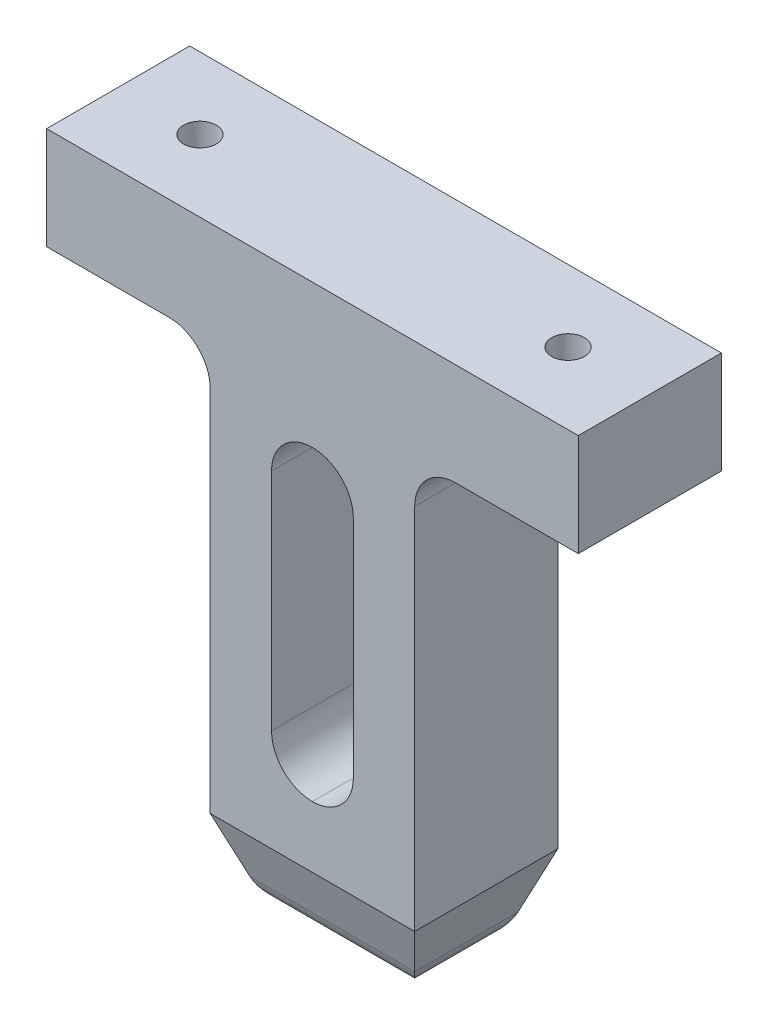
from build123d import *

# Parameters (mm, degrees)
SKETCH1_W           = 7
SKETCH1_H           = 5
BOSS_EXTRUDE1_DEPTH = 26
SKETCH3_R           = 0.8
CUT_EXTRUDE1_DEPTH  = 7
SKETCH4_W           = 10
SKETCH4_H           = 7
BOSS_EXTRUDE2_DEPTH = 20
SKETCH5_W           = 4
SKETCH5_H           = 15
CUT_EXTRUDE2_DEPTH  = 20
SKETCH6_W           = 10
SKETCH6_H           = 7
BOSS_EXTRUDE3_DEPTH = 4
BOSS_EXTRUDE3_TAPER = 20
FILLET2_R           = 2
FILLET5_R           = 2
FILLET8_R           = 2


with BuildPart() as part:
    # Sketch1 → Boss-Extrude1 (new body)
    with BuildSketch(Plane(origin=(0, 0, 0), x_dir=(0, 0, -1), z_dir=(1, 0, 0))):
        Rectangle(SKETCH1_W, SKETCH1_H)
    extrude(amount=BOSS_EXTRUDE1_DEPTH)

    # Sketch3 → Cut-Extrude1 (cut)
    with BuildSketch(Plane(origin=(0, 2.5, -8.047205284), x_dir=(1, 0, 0), z_dir=(0, -1, 0))):
        with Locations(Location((4, 8.047205284, 0), (0, 0, 90))):
            Circle(SKETCH3_R)
        with Locations(Location((22, 8.047205284, 0), (0, 0, 90))):
            Circle(SKETCH3_R)
    extrude(amount=CUT_EXTRUDE1_DEPTH, mode=Mode.SUBTRACT)

    # Sketch4 → Boss-Extrude2 (add)
    with BuildSketch(Plane.XZ.offset(2.5)):
        with Locations((13, 0)):
            Rectangle(SKETCH4_W, SKETCH4_H)
    extrude(amount=BOSS_EXTRUDE2_DEPTH)

    # Sketch5 → Cut-Extrude2 (cut)
    with BuildSketch(Plane.XY.offset(3.5)):
        with Locations((13, -12)):
            Rectangle(SKETCH5_W, SKETCH5_H)
    extrude(amount=-CUT_EXTRUDE2_DEPTH, mode=Mode.SUBTRACT)

    # Fillet2
    fillet2_edges = [part.edges().sort_by_distance(p)[0] for p in [
        (15, -4.5, 0),
        (11, -4.5, 0),
        (15, -19.5, 0),
        (11, -19.5, 0),
    ]]
    fillet(fillet2_edges, radius=FILLET2_R - 0.0001)  # a hair under: the kernel refuses the full size

    # Fillet5
    fillet5_edges = [part.edges().sort_by_distance(p)[0] for p in [
        (8, -2.5, 0),
        (18, -2.5, 0),
    ]]
    fillet(fillet5_edges, radius=FILLET5_R)


with BuildPart() as body_2:
    # Sketch6 → Boss-Extrude3 (new body)
    with BuildSketch(Plane.XZ.offset(22.5)):
        with Locations((13, 0)):
            Rectangle(SKETCH6_W, SKETCH6_H)
    extrude(amount=BOSS_EXTRUDE3_DEPTH, taper=BOSS_EXTRUDE3_TAPER)

    # Fillet8
    fillet8_edges = [body_2.edges().sort_by_distance(p)[0] for p in [
        (9.455880937, -26.5, 0),
        (13, -26.5, -2.044119063),
        (16.544119063, -26.5, 0),
        (13, -26.5, 2.044119063),
    ]]
    fillet(fillet8_edges, radius=FILLET8_R)


solid = Compound([part.part, body_2.part])
